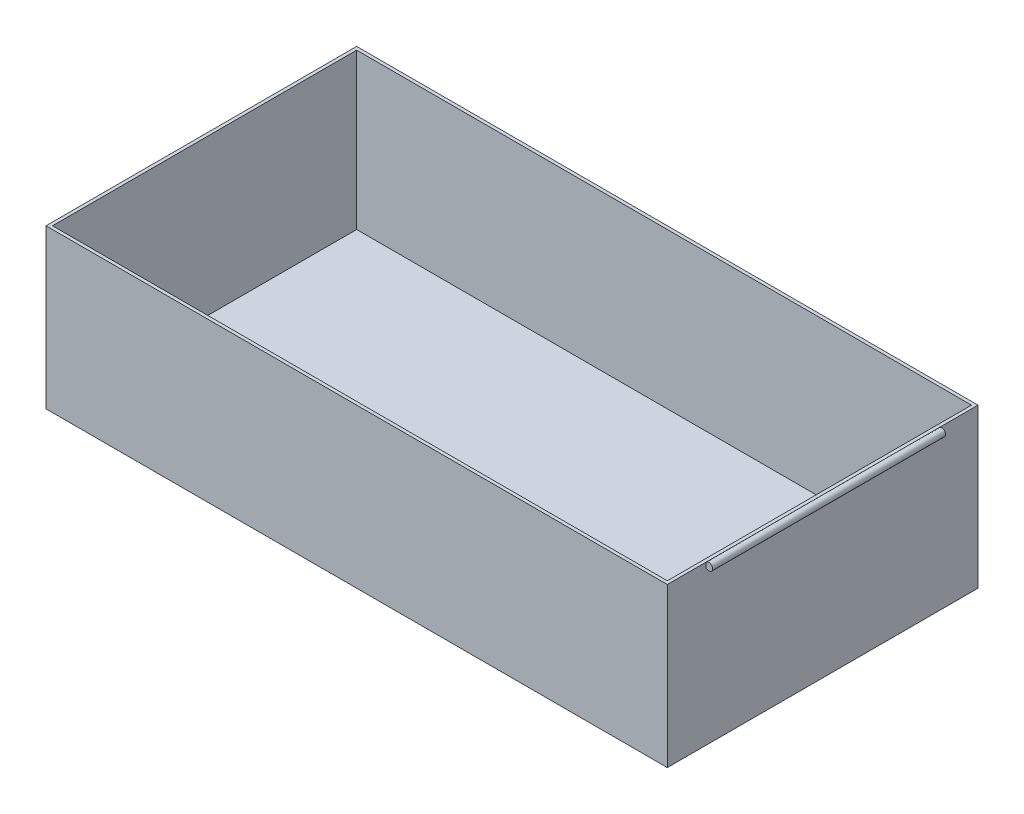
from build123d import *

# Parameters (mm, degrees)
SKETCH1_W           = 304.8
SKETCH1_H           = 152.4
BOSS_EXTRUDE1_DEPTH = 1.5875
SKETCH2_W           = 304.8
SKETCH2_H           = 152.4
SKETCH2_W_2         = 301.625
SKETCH2_H_2         = 149.225
BOSS_EXTRUDE2_DEPTH = 76.2
BOSS_EXTRUDE3_DEPTH = 57.15


with BuildPart() as part:
    # Sketch1 → Boss-Extrude1 (new body)
    with BuildSketch(Plane(origin=(0, 0, 0), x_dir=(1, 0, 0), z_dir=(0, 1, 0))):
        Rectangle(SKETCH1_W, SKETCH1_H)
    extrude(amount=BOSS_EXTRUDE1_DEPTH)

    # Sketch2 → Boss-Extrude2 (add)
    with BuildSketch(Plane(origin=(0, 1.5875, 0), x_dir=(1, 0, 0), z_dir=(0, 1, 0))):
        Rectangle(SKETCH2_W, SKETCH2_H)
        Rectangle(SKETCH2_W_2, SKETCH2_H_2, mode=Mode.SUBTRACT)
    extrude(amount=BOSS_EXTRUDE2_DEPTH)

    # Sketch3 → Boss-Extrude3 (add, symmetric)
    with BuildSketch(Plane.XY):
        with BuildLine():
            ThreePointArc((152.4, 75.18002351), (155.547502553, 76.483761755), (152.4, 77.7875))
            Line((152.4, 77.7875), (152.4, 75.18002351))
        make_face()
    extrude(amount=BOSS_EXTRUDE3_DEPTH, both=True)


solid = part.part
